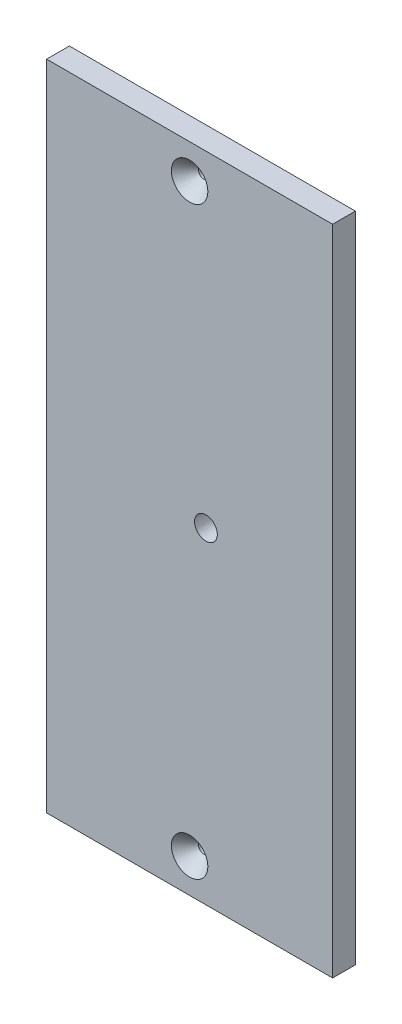
from build123d import *

# Parameters (mm, degrees)
SKETCH1_W                   = 79.793650836
SKETCH1_H                   = 182.149999994
BOSS_EXTRUDE1_DEPTH         = 6.35
F_1_4_0_25_DIAMETER_HOLE1_D = 6.35
HOLE1_D                     = 3.175
HOLE1_DEPTH                 = 31.75
HOLE1_CSINK_D               = 10.16
HOLE1_CSINK_ANGLE           = 82
HOLE1_TIP                   = 0.953866233


with BuildPart() as part:
    # Sketch1 → Boss-Extrude1 (new body)
    with BuildSketch(Plane.XY):
        with Locations((-274.649792599, -72.024999997)):
            Rectangle(SKETCH1_W, SKETCH1_H)
    extrude(amount=BOSS_EXTRUDE1_DEPTH)

    # 1/4 (0.25) Diameter Hole1 (through all)
    with Locations(Plane.XY.offset(6.35)):
        with Locations((-270.096618017, -72.024999997)):
            Hole(F_1_4_0_25_DIAMETER_HOLE1_D / 2)

    # Hole1
    with Locations(Plane(origin=(181.039434513, -72.024999997, 6.35), x_dir=(0, 1, 0), z_dir=(0, 0, 1))):
        with Locations((81.549999997, 455.689227112), (-81.549999997, 455.689227112)):
            CounterSinkHole(HOLE1_D / 2, HOLE1_CSINK_D / 2, depth=HOLE1_DEPTH, counter_sink_angle=HOLE1_CSINK_ANGLE)
            with Locations((0, 0, -(HOLE1_DEPTH + HOLE1_TIP / 2))):  # 118° drill point
                Cone(0, HOLE1_D / 2, HOLE1_TIP, mode=Mode.SUBTRACT)


solid = part.part
